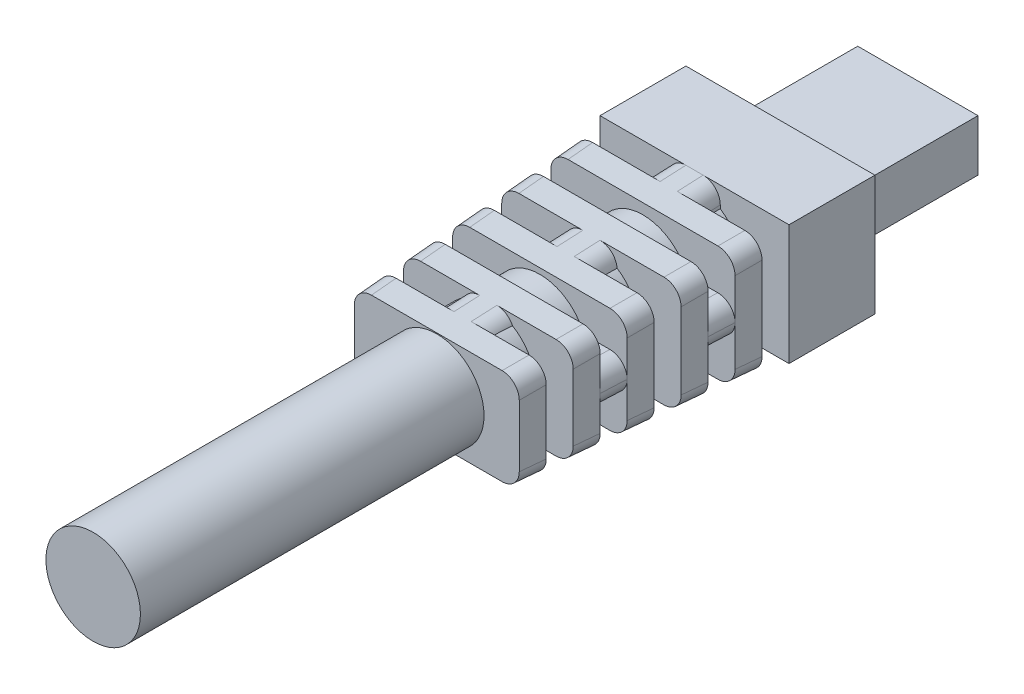
from build123d import *
from OCP.BRepFilletAPI import BRepFilletAPI_MakeChamfer

# Parameters (mm, degrees)
SKETCH_1_W           = 7
SKETCH_1_H           = 3
EXTRUDE_1_DEPTH      = 8
SKETCH_2_W           = 11
SKETCH_2_H           = 7
EXTRUDE_2_DEPTH      = 5
SKETCH_3_W           = 11
SKETCH_3_H           = 7
EXTRUDE_3_DEPTH      = 15
CHAMFER_1_SIZE       = 15
CHAMFER_1_SIZE2      = 0.7
SKETCH_5_W           = 1.5
SKETCH_5_H           = 2.5
CUT_EXTRUDE_1_DEPTH  = 4
FILLET_1_R           = 1
FILLET_2_R           = 1
SKETCH_6_W           = 1.5
SKETCH_6_H           = 2
CUT_EXTRUDE_2_DEPTH  = 4
SKETCH_7_W           = 3
SKETCH_7_H           = 1.5
CUT_EXTRUDE_3_DEPTH  = 4
FILLET_3_R           = 1
FILLET_4_R           = 1
FILLET_5_R           = 1
FILLET_6_R           = 1
EXTRUDE_4_DEPTH      = 20
EXTRUDE_4_DEPTH_BACK = 20
SKETCH_8_R           = 2.75


# Some blends are built 0.0001 mm under size
with BuildPart() as part:
    # Эскиз1 → Бобышка-Вытянуть1 (new body)
    with BuildSketch(Plane.XY):
        with Locations((-3.5, 1.5)):
            Rectangle(SKETCH_1_W, SKETCH_1_H)
    extrude(amount=EXTRUDE_1_DEPTH)

    # Эскиз2 → Бобышка-Вытянуть2 (add)
    with BuildSketch(Plane.XY.offset(8)):
        with Locations((-3.5, 1.5)):
            Rectangle(SKETCH_2_W, SKETCH_2_H)
    extrude(amount=EXTRUDE_2_DEPTH)

    # Эскиз3 → Бобышка-Вытянуть3 (add)
    with BuildSketch(Plane.XY.offset(13)):
        with Locations((-3.5, 1.5)):
            Rectangle(SKETCH_3_W, SKETCH_3_H)
    extrude(amount=EXTRUDE_3_DEPTH)

    # Фаска1: one chamfer whose edges measure the first distance from different faces: ONE call of the kernel's chamfer builder (chamfer() names one face for all edges)
    chamfer_1_edges_1 = [part.edges().sort_by_distance(p)[0] for p in [
        (-9, 1.5, 28),
    ]]
    chamfer_1_side_1 = [part.faces().sort_by_distance(p)[0] for p in [
        (-9, 1.5, 18),
    ]]
    chamfer_1_edges_2 = [part.edges().sort_by_distance(p)[0] for p in [
        (-3.5, -2, 28),
    ]]
    chamfer_1_side_2 = [part.faces().sort_by_distance(p)[0] for p in [
        (-3.5, -2, 18),
    ]]
    chamfer_1_edges_3 = [part.edges().sort_by_distance(p)[0] for p in [
        (2, 1.5, 28),
    ]]
    chamfer_1_side_3 = [part.faces().sort_by_distance(p)[0] for p in [
        (2, 1.5, 18),
    ]]
    chamfer_1_edges_4 = [part.edges().sort_by_distance(p)[0] for p in [
        (-3.5, 5, 28),
    ]]
    chamfer_1_side_4 = [part.faces().sort_by_distance(p)[0] for p in [
        (-3.5, 5, 18),
    ]]
    chamfer_1 = BRepFilletAPI_MakeChamfer(part.part.solid().wrapped)
    for e in chamfer_1_edges_1:
        chamfer_1.Add(CHAMFER_1_SIZE, CHAMFER_1_SIZE2, e.wrapped, chamfer_1_side_1[0].wrapped)  # the first distance lies on this face
    for e in chamfer_1_edges_2:
        chamfer_1.Add(CHAMFER_1_SIZE, CHAMFER_1_SIZE2, e.wrapped, chamfer_1_side_2[0].wrapped)  # the first distance lies on this face
    for e in chamfer_1_edges_3:
        chamfer_1.Add(CHAMFER_1_SIZE, CHAMFER_1_SIZE2, e.wrapped, chamfer_1_side_3[0].wrapped)  # the first distance lies on this face
    for e in chamfer_1_edges_4:
        chamfer_1.Add(CHAMFER_1_SIZE, CHAMFER_1_SIZE2, e.wrapped, chamfer_1_side_4[0].wrapped)  # the first distance lies on this face
    add(Compound.cast(chamfer_1.Shape()), mode=Mode.REPLACE)

    # Эскиз5 → Вырез-Вытянуть1 (cut)
    with BuildSketch(Plane.ZY.offset(9)):
        with Locations((16.75, -0.75)):
            Rectangle(SKETCH_5_W, SKETCH_5_H)
        with Locations((13.75, -0.75)):
            Rectangle(SKETCH_5_W, SKETCH_5_H)
        with Locations((19.75, -0.75)):
            Rectangle(SKETCH_5_W, SKETCH_5_H)
        with Locations((22.75, -0.75)):
            Rectangle(SKETCH_5_W, SKETCH_5_H)
        with Locations((25.75, -0.75)):
            Rectangle(SKETCH_5_W, SKETCH_5_H)
        with Locations((16.75, 3.75)):
            Rectangle(SKETCH_5_W, SKETCH_5_H)
        with Locations((19.75, 3.75)):
            Rectangle(SKETCH_5_W, SKETCH_5_H)
        with Locations((22.75, 3.75)):
            Rectangle(SKETCH_5_W, SKETCH_5_H)
        with Locations((25.75, 3.75)):
            Rectangle(SKETCH_5_W, SKETCH_5_H)
        with Locations((13.75, 3.75)):
            Rectangle(SKETCH_5_W, SKETCH_5_H)
    cut_extrude_1 = extrude(amount=-CUT_EXTRUDE_1_DEPTH, mode=Mode.SUBTRACT)

    # Зеркальное отражение1: Вырез-Вытянуть1 across plane
    add(cut_extrude_1.mirror(Plane.ZY.offset(3.5)), mode=Mode.SUBTRACT)

    # Скругление1
    fillet_1_edges = [part.edges().sort_by_distance(p)[0] for p in [
        (-8.475, -1.475, 24.25),
        (-8.755, 4.755, 18.25),
        (-8.615, 4.615, 21.25),
        (-8.475, 4.475, 24.25),
        (-8.335, 4.335, 27.25),
        (-8.895, 4.895, 15.25),
        (-8.335, -1.335, 27.25),
        (-8.895, -1.895, 15.25),
        (-8.755, -1.755, 18.25),
        (-8.615, -1.615, 21.25),
    ]]
    fillet(fillet_1_edges, radius=FILLET_1_R)

    # Скругление2
    fillet_2_edges = [part.edges().sort_by_distance(p)[0] for p in [
        (1.895, -1.895, 15.25),
        (1.755, -1.755, 18.25),
        (1.615, -1.615, 21.25),
        (1.475, -1.475, 24.25),
        (1.755, 4.755, 18.25),
        (1.615, 4.615, 21.25),
        (1.475, 4.475, 24.25),
        (1.335, 4.335, 27.25),
        (1.895, 4.895, 15.25),
        (1.335, -1.335, 27.25),
    ]]
    fillet(fillet_2_edges, radius=FILLET_2_R)

    # Эскиз6 → Вырез-Вытянуть2 (cut)
    with BuildSketch(Plane.ZY.offset(9)):
        with Locations((19.75, 1.5)):
            Rectangle(SKETCH_6_W, SKETCH_6_H)
        with Locations((13.75, 1.5)):
            Rectangle(SKETCH_6_W, SKETCH_6_H)
        with Locations((25.75, 1.5)):
            Rectangle(SKETCH_6_W, SKETCH_6_H)
    cut_extrude_2 = extrude(amount=-CUT_EXTRUDE_2_DEPTH, mode=Mode.SUBTRACT)

    # Зеркальное отражение4: Вырез-Вытянуть2 across plane
    add(cut_extrude_2.mirror(Plane.ZY.offset(3.5)), mode=Mode.SUBTRACT)

    # Эскиз7 → Вырез-Вытянуть3 (cut)
    with BuildSketch(Plane(origin=(0, 5, 0), x_dir=(1, 0, 0), z_dir=(0, 1, 0))):
        with Locations((-3.5, -22.75)):
            Rectangle(SKETCH_7_W, SKETCH_7_H)
        with Locations((-3.5, -16.75)):
            Rectangle(SKETCH_7_W, SKETCH_7_H)
    cut_extrude_3 = extrude(amount=-CUT_EXTRUDE_3_DEPTH, mode=Mode.SUBTRACT)

    # Зеркальное отражение5: Вырез-Вытянуть3 across plane
    add(cut_extrude_3.mirror(Plane(origin=(0, 1.5, 0), x_dir=(0, 0, 1), z_dir=(0, -1, 0))), mode=Mode.SUBTRACT)

    # Скругление3
    # the kernel refuses this fillet: 1 mm, written as the material it takes off along each edge
    with BuildSketch(Plane(origin=(-5, -1.253460163, 28.997282216), x_dir=(1, 0, 0), z_dir=(0, -0.046615934699044036, -0.9989128864080864))) as fillet_3_piece_1_section:
        with BuildLine():
            CenterArc((FILLET_3_R, -FILLET_3_R), FILLET_3_R, 90, 90)
            Line((0, -FILLET_3_R), (0, 0))
            Line((0, 0), (FILLET_3_R, 0))
        make_face()
    fillet_3_piece_1 = extrude(amount=6.501632445, mode=Mode.PRIVATE)
    fillet_3_piece_1 = split(fillet_3_piece_1, bisect_by=Plane(origin=(-4.773604886, -1.178358501, 26.5), z_dir=(0, 0, -1)), keep=Keep.TOP, mode=Mode.PRIVATE)
    fillet_3_piece_1 = split(fillet_3_piece_1, bisect_by=Plane(origin=(-4.773604886, -1.178358501, 25), z_dir=(0, 0, 1)), keep=Keep.TOP, mode=Mode.PRIVATE)
    add(fillet_3_piece_1, mode=Mode.SUBTRACT)
    with BuildSketch(Plane(origin=(-2, -1.813460163, 16.997282216), x_dir=(-1, 0, 0), z_dir=(0, -0.046615934699044036, -0.9989128864080864))) as fillet_3_piece_2_section:
        with BuildLine():
            CenterArc((FILLET_3_R, FILLET_3_R), FILLET_3_R, 180, 90)
            Line((0, FILLET_3_R), (0, 0))
            Line((0, 0), (FILLET_3_R, 0))
        make_face()
    fillet_3_piece_2 = extrude(amount=6.501632445, mode=Mode.PRIVATE)
    fillet_3_piece_2 = split(fillet_3_piece_2, bisect_by=Plane(origin=(-2.226395114, -1.738358501, 13), z_dir=(0, 0, 1)), keep=Keep.TOP, mode=Mode.PRIVATE)
    fillet_3_piece_2 = split(fillet_3_piece_2, bisect_by=Plane(origin=(-2.226395114, -1.738358501, 14.5), z_dir=(0, 0, -1)), keep=Keep.TOP, mode=Mode.PRIVATE)
    add(fillet_3_piece_2, mode=Mode.SUBTRACT)
    with BuildSketch(Plane(origin=(-2, -1.533460163, 22.997282216), x_dir=(-1, 0, 0), z_dir=(0, -0.046615934699044036, -0.9989128864080864))) as fillet_3_piece_3_section:
        with BuildLine():
            CenterArc((FILLET_3_R, FILLET_3_R), FILLET_3_R, 180, 90)
            Line((0, FILLET_3_R), (0, 0))
            Line((0, 0), (FILLET_3_R, 0))
        make_face()
    fillet_3_piece_3 = extrude(amount=6.501632445, mode=Mode.PRIVATE)
    fillet_3_piece_3 = split(fillet_3_piece_3, bisect_by=Plane(origin=(-2.226395114, -1.458358501, 19), z_dir=(0, 0, 1)), keep=Keep.TOP, mode=Mode.PRIVATE)
    fillet_3_piece_3 = split(fillet_3_piece_3, bisect_by=Plane(origin=(-2.226395114, -1.458358501, 20.5), z_dir=(0, 0, -1)), keep=Keep.TOP, mode=Mode.PRIVATE)
    add(fillet_3_piece_3, mode=Mode.SUBTRACT)
    with BuildSketch(Plane(origin=(-2, -1.253460163, 28.997282216), x_dir=(-1, 0, 0), z_dir=(0, -0.046615934699044036, -0.9989128864080864))) as fillet_3_piece_4_section:
        with BuildLine():
            CenterArc((FILLET_3_R, FILLET_3_R), FILLET_3_R, 180, 90)
            Line((0, FILLET_3_R), (0, 0))
            Line((0, 0), (FILLET_3_R, 0))
        make_face()
    fillet_3_piece_4 = extrude(amount=6.501632445, mode=Mode.PRIVATE)
    fillet_3_piece_4 = split(fillet_3_piece_4, bisect_by=Plane(origin=(-2.226395114, -1.178358501, 25), z_dir=(0, 0, 1)), keep=Keep.TOP, mode=Mode.PRIVATE)
    fillet_3_piece_4 = split(fillet_3_piece_4, bisect_by=Plane(origin=(-2.226395114, -1.178358501, 26.5), z_dir=(0, 0, -1)), keep=Keep.TOP, mode=Mode.PRIVATE)
    add(fillet_3_piece_4, mode=Mode.SUBTRACT)
    with BuildSketch(Plane(origin=(-5, -1.813460163, 16.997282216), x_dir=(1, 0, 0), z_dir=(0, -0.046615934699044036, -0.9989128864080864))) as fillet_3_piece_5_section:
        with BuildLine():
            CenterArc((FILLET_3_R, -FILLET_3_R), FILLET_3_R, 90, 90)
            Line((0, -FILLET_3_R), (0, 0))
            Line((0, 0), (FILLET_3_R, 0))
        make_face()
    fillet_3_piece_5 = extrude(amount=6.501632445, mode=Mode.PRIVATE)
    fillet_3_piece_5 = split(fillet_3_piece_5, bisect_by=Plane(origin=(-4.773604886, -1.738358501, 13), z_dir=(0, 0, 1)), keep=Keep.TOP, mode=Mode.PRIVATE)
    fillet_3_piece_5 = split(fillet_3_piece_5, bisect_by=Plane(origin=(-4.773604886, -1.738358501, 14.5), z_dir=(0, 0, -1)), keep=Keep.TOP, mode=Mode.PRIVATE)
    add(fillet_3_piece_5, mode=Mode.SUBTRACT)
    with BuildSketch(Plane(origin=(-5, -1.533460163, 22.997282216), x_dir=(1, 0, 0), z_dir=(0, -0.046615934699044036, -0.9989128864080864))) as fillet_3_piece_6_section:
        with BuildLine():
            CenterArc((FILLET_3_R, -FILLET_3_R), FILLET_3_R, 90, 90)
            Line((0, -FILLET_3_R), (0, 0))
            Line((0, 0), (FILLET_3_R, 0))
        make_face()
    fillet_3_piece_6 = extrude(amount=6.501632445, mode=Mode.PRIVATE)
    fillet_3_piece_6 = split(fillet_3_piece_6, bisect_by=Plane(origin=(-4.773604886, -1.458358501, 20.5), z_dir=(0, 0, -1)), keep=Keep.TOP, mode=Mode.PRIVATE)
    fillet_3_piece_6 = split(fillet_3_piece_6, bisect_by=Plane(origin=(-4.773604886, -1.458358501, 19), z_dir=(0, 0, 1)), keep=Keep.TOP, mode=Mode.PRIVATE)
    add(fillet_3_piece_6, mode=Mode.SUBTRACT)

    # Скругление4
    fillet_4_edges = [part.edges().sort_by_distance(p)[0] for p in [
        (1.825, 0.5, 16.75),
        (1.545, 0.5, 22.75),
        (1.825, 2.5, 16.75),
        (1.545, 2.5, 22.75),
    ]]
    fillet(fillet_4_edges, radius=FILLET_4_R - 0.0001)  # a hair under: the kernel refuses the full size

    # Скругление5
    # the kernel refuses this fillet: 1 mm, written as the material it takes off along each edge
    with BuildSketch(Plane(origin=(-5, 4.836539837, 16.502717784), x_dir=(0, -0.9989128864080864, -0.046615934699044057), z_dir=(0, -0.04661593469904405, 0.9989128864080864))) as fillet_5_piece_1_section:
        with BuildLine():
            CenterArc((FILLET_5_R, FILLET_5_R), FILLET_5_R, 180, 90)
            Line((0, FILLET_5_R), (0, 0))
            Line((0, 0), (FILLET_5_R, 0))
        make_face()
    fillet_5_piece_1 = extrude(amount=6.501632445, mode=Mode.PRIVATE)
    fillet_5_piece_1 = split(fillet_5_piece_1, bisect_by=Plane(origin=(-4.773604886, 4.458358501, 19), z_dir=(0, 0, 1)), keep=Keep.TOP, mode=Mode.PRIVATE)
    fillet_5_piece_1 = split(fillet_5_piece_1, bisect_by=Plane(origin=(-4.773604886, 4.458358501, 20.5), z_dir=(0, 0, -1)), keep=Keep.TOP, mode=Mode.PRIVATE)
    add(fillet_5_piece_1, mode=Mode.SUBTRACT)
    with BuildSketch(Plane(origin=(-5, 4.556539837, 22.502717784), x_dir=(0, -0.9989128864080864, -0.046615934699044057), z_dir=(0, -0.04661593469904405, 0.9989128864080864))) as fillet_5_piece_2_section:
        with BuildLine():
            CenterArc((FILLET_5_R, FILLET_5_R), FILLET_5_R, 180, 90)
            Line((0, FILLET_5_R), (0, 0))
            Line((0, 0), (FILLET_5_R, 0))
        make_face()
    fillet_5_piece_2 = extrude(amount=6.501632445, mode=Mode.PRIVATE)
    fillet_5_piece_2 = split(fillet_5_piece_2, bisect_by=Plane(origin=(-4.773604886, 4.178358501, 25), z_dir=(0, 0, 1)), keep=Keep.TOP, mode=Mode.PRIVATE)
    fillet_5_piece_2 = split(fillet_5_piece_2, bisect_by=Plane(origin=(-4.773604886, 4.178358501, 26.5), z_dir=(0, 0, -1)), keep=Keep.TOP, mode=Mode.PRIVATE)
    add(fillet_5_piece_2, mode=Mode.SUBTRACT)
    with BuildSketch(Plane(origin=(-5, 5.116539837, 10.502717784), x_dir=(1, 0, 0), z_dir=(0, -0.04661593469904405, 0.9989128864080864))) as fillet_5_piece_3_section:
        with BuildLine():
            CenterArc((FILLET_5_R, -FILLET_5_R), FILLET_5_R, 90, 90)
            Line((0, -FILLET_5_R), (0, 0))
            Line((0, 0), (FILLET_5_R, 0))
        make_face()
    fillet_5_piece_3 = extrude(amount=6.501632445, mode=Mode.PRIVATE)
    fillet_5_piece_3 = split(fillet_5_piece_3, bisect_by=Plane(origin=(-4.773604886, 4.738358501, 14.5), z_dir=(0, 0, -1)), keep=Keep.TOP, mode=Mode.PRIVATE)
    fillet_5_piece_3 = split(fillet_5_piece_3, bisect_by=Plane(origin=(-4.773604886, 4.738358501, 13), z_dir=(0, 0, 1)), keep=Keep.TOP, mode=Mode.PRIVATE)
    add(fillet_5_piece_3, mode=Mode.SUBTRACT)
    with BuildSketch(Plane(origin=(-2, 4.836539837, 16.502717784), x_dir=(-1, 0, 0), z_dir=(0, -0.04661593469904405, 0.9989128864080864))) as fillet_5_piece_4_section:
        with BuildLine():
            CenterArc((FILLET_5_R, FILLET_5_R), FILLET_5_R, 180, 90)
            Line((0, FILLET_5_R), (0, 0))
            Line((0, 0), (FILLET_5_R, 0))
        make_face()
    fillet_5_piece_4 = extrude(amount=6.501632445, mode=Mode.PRIVATE)
    fillet_5_piece_4 = split(fillet_5_piece_4, bisect_by=Plane(origin=(-2.226395114, 4.458358501, 19), z_dir=(0, 0, 1)), keep=Keep.TOP, mode=Mode.PRIVATE)
    fillet_5_piece_4 = split(fillet_5_piece_4, bisect_by=Plane(origin=(-2.226395114, 4.458358501, 20.5), z_dir=(0, 0, -1)), keep=Keep.TOP, mode=Mode.PRIVATE)
    add(fillet_5_piece_4, mode=Mode.SUBTRACT)
    with BuildSketch(Plane(origin=(-2, 4.556539837, 22.502717784), x_dir=(-1, 0, 0), z_dir=(0, -0.04661593469904405, 0.9989128864080864))) as fillet_5_piece_5_section:
        with BuildLine():
            CenterArc((FILLET_5_R, FILLET_5_R), FILLET_5_R, 180, 90)
            Line((0, FILLET_5_R), (0, 0))
            Line((0, 0), (FILLET_5_R, 0))
        make_face()
    fillet_5_piece_5 = extrude(amount=6.501632445, mode=Mode.PRIVATE)
    fillet_5_piece_5 = split(fillet_5_piece_5, bisect_by=Plane(origin=(-2.226395114, 4.178358501, 25), z_dir=(0, 0, 1)), keep=Keep.TOP, mode=Mode.PRIVATE)
    fillet_5_piece_5 = split(fillet_5_piece_5, bisect_by=Plane(origin=(-2.226395114, 4.178358501, 26.5), z_dir=(0, 0, -1)), keep=Keep.TOP, mode=Mode.PRIVATE)
    add(fillet_5_piece_5, mode=Mode.SUBTRACT)
    with BuildSketch(Plane(origin=(-2, 5.116539837, 10.502717784), x_dir=(-1, 0, 0), z_dir=(0, -0.04661593469904405, 0.9989128864080864))) as fillet_5_piece_6_section:
        with BuildLine():
            CenterArc((FILLET_5_R, FILLET_5_R), FILLET_5_R, 180, 90)
            Line((0, FILLET_5_R), (0, 0))
            Line((0, 0), (FILLET_5_R, 0))
        make_face()
    fillet_5_piece_6 = extrude(amount=6.501632445, mode=Mode.PRIVATE)
    fillet_5_piece_6 = split(fillet_5_piece_6, bisect_by=Plane(origin=(-2.226395114, 4.738358501, 13), z_dir=(0, 0, 1)), keep=Keep.TOP, mode=Mode.PRIVATE)
    fillet_5_piece_6 = split(fillet_5_piece_6, bisect_by=Plane(origin=(-2.226395114, 4.738358501, 14.5), z_dir=(0, 0, -1)), keep=Keep.TOP, mode=Mode.PRIVATE)
    add(fillet_5_piece_6, mode=Mode.SUBTRACT)

    # Скругление6
    fillet_6_edges = [part.edges().sort_by_distance(p)[0] for p in [
        (-8.545, 0.5, 22.75),
        (-8.825, 2.5, 16.75),
        (-8.545, 2.5, 22.75),
        (-8.825, 0.5, 16.75),
    ]]
    fillet(fillet_6_edges, radius=FILLET_6_R - 0.0001)  # a hair under: the kernel refuses the full size

    # Эскиз8 → Бобышка-Вытянуть4 (add, two sides: drawn at the far end of the back side and taken through both)
    with BuildSketch(Plane.XY.offset(28).offset(-EXTRUDE_4_DEPTH_BACK)):
        with Locations((-3.5, 1.5)):
            Circle(SKETCH_8_R)
    extrude(amount=EXTRUDE_4_DEPTH + EXTRUDE_4_DEPTH_BACK)


solid = part.part
